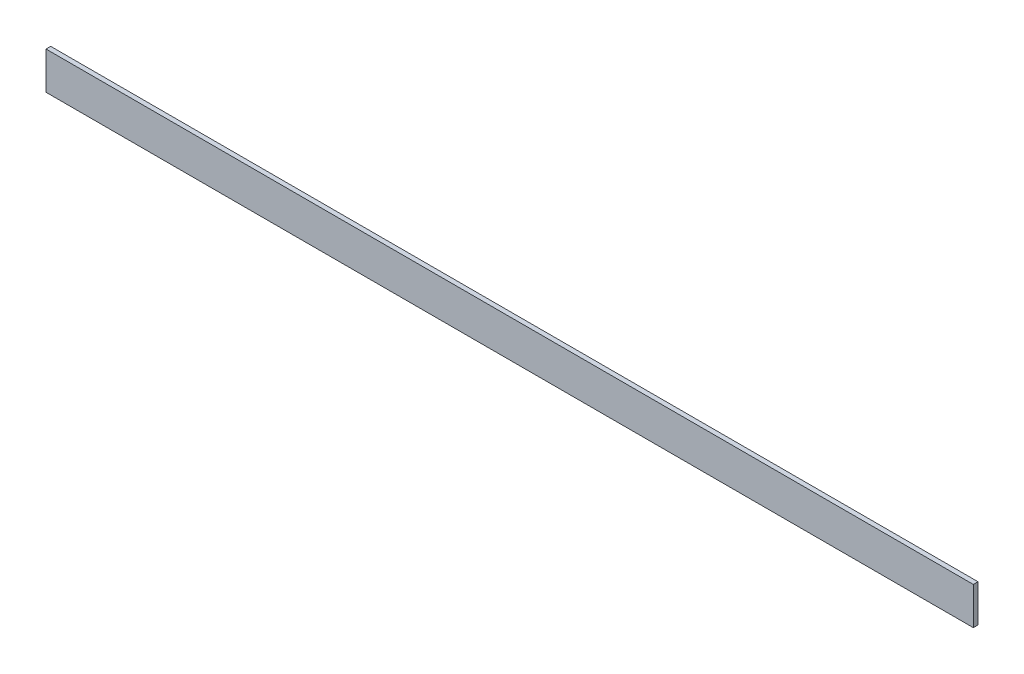
from build123d import *

# Parameters (mm, degrees)
SKETCH1_W           = 3.175
SKETCH1_H           = 25.4
BOSS_EXTRUDE1_DEPTH = 628.65


with BuildPart() as part:
    # Sketch1 → Boss-Extrude1 (new body)
    with BuildSketch(Plane(origin=(0, 0, 0), x_dir=(0, 0, -1), z_dir=(1, 0, 0))):
        with Locations((1.5875, 12.7)):
            Rectangle(SKETCH1_W, SKETCH1_H)
    extrude(amount=BOSS_EXTRUDE1_DEPTH)


solid = part.part
